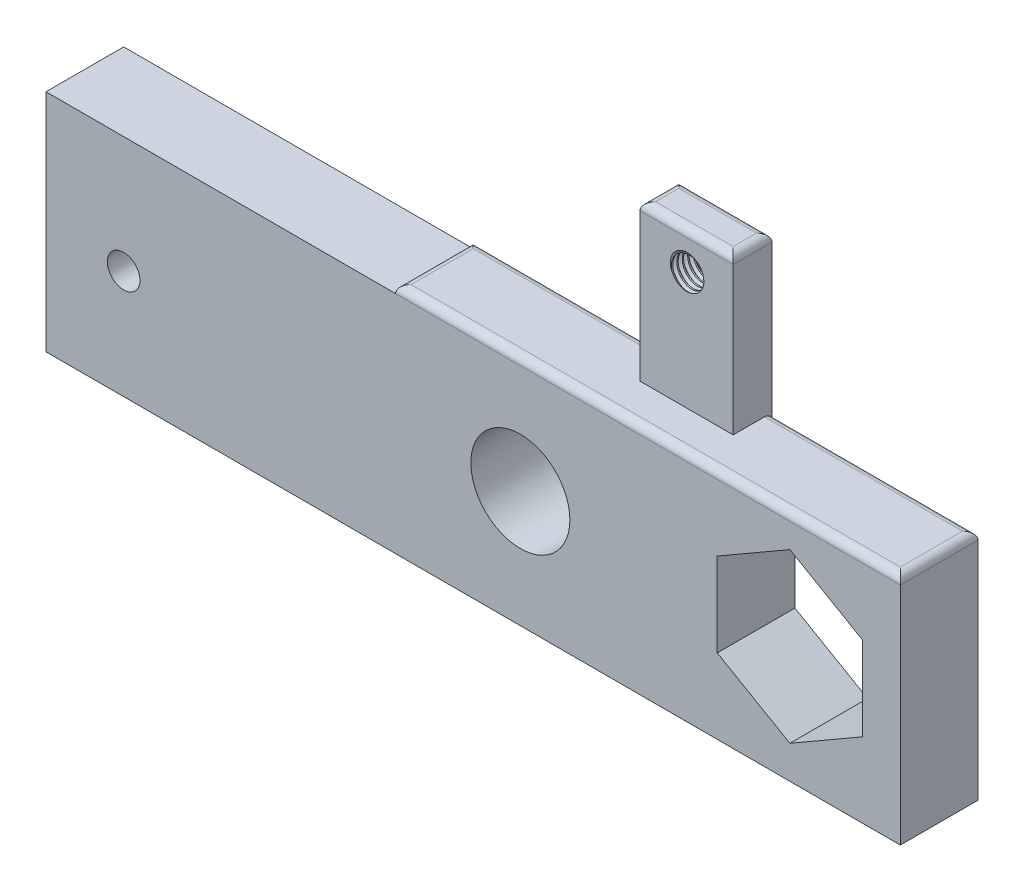
from build123d import *

# Parameters (mm, degrees)
SKETCH1_W           = 65
SKETCH1_H           = 30
BOSS_EXTRUDE1_DEPTH = 10
SKETCH2_R           = 6.375
CUT_EXTRUDE1_DEPTH  = 10
SKETCH4_W           = 12
SKETCH4_H           = 5
BOSS_EXTRUDE5_DEPTH = 20
SKETCH9_R           = 2
CUT_EXTRUDE3_DEPTH  = 30
THREAD1_PITCH       = 0.7
FILLET1_R           = 1
SKETCH10_W          = 10
SKETCH10_H          = 29
BOSS_EXTRUDE6_DEPTH = 45
SKETCH11_R          = 2.1
CUT_EXTRUDE4_DEPTH  = 50


with BuildPart() as part:
    # Sketch1 → Boss-Extrude1 (new body)
    with BuildSketch(Plane.XY):
        Rectangle(SKETCH1_W, SKETCH1_H)
    extrude(amount=BOSS_EXTRUDE1_DEPTH)

    # Sketch2 → Cut-Extrude1 (cut)
    with BuildSketch(Plane.XY.offset(10)):
        with Locations((-16.423651497, -0.024123926)):
            Circle(SKETCH2_R)
        Polygon((18.279422863, -10.760304849), (27.632497224, -5.360304849), (27.632497224, 5.439695151), (18.279422863, 10.839695151), (8.926348503, 5.439695151), (8.926348503, -5.360304849), align=None)
    extrude(amount=-CUT_EXTRUDE1_DEPTH, mode=Mode.SUBTRACT)

    # Sketch4 → Boss-Extrude5 (add, symmetric)
    with BuildSketch(Plane(origin=(0, 15, 0), x_dir=(1, 0, 0), z_dir=(0, 1, 0))):
        with Locations((0, -2.5242509)):
            Rectangle(SKETCH4_W, SKETCH4_H)
    extrude(amount=BOSS_EXTRUDE5_DEPTH, both=True)

    # Sketch9 → Cut-Extrude3 (cut, symmetric)
    with BuildSketch(Plane(origin=(0, 0, 0), x_dir=(-1, 0, 0), z_dir=(0, 0, -1))):
        with Locations((0, 30)):
            Circle(SKETCH9_R)
    extrude(amount=CUT_EXTRUDE3_DEPTH, both=True, mode=Mode.SUBTRACT)

    # Thread1: the profile of Thread Profile2 profile screwed along a right-hand helix of 14.285714 turns, 6 arcs to a turn; built about Z, then put on its axis
    thread1_z = Axis((0, 0, 0), (0, 0, 1))
    thread1_corners = [(1.9997, 0, -0.000173205), (2.378886113, 0, 0.218749999), (2.378886113, 0, 0.306249999), (1.9997, 0, 0.525173203)]
    with BuildLine(mode=Mode.PRIVATE) as thread1_profile:
        Line(thread1_corners[0], thread1_corners[1])
        Line(thread1_corners[1], thread1_corners[2])
        Line(thread1_corners[2], thread1_corners[3])
        Line(thread1_corners[3], thread1_corners[0])
    thread1_cap = Face(thread1_profile.wire())
    thread1_turn_angles = [0, 30, 60, 90, 120, 150, 180, 210, 240, 270, 300, 330, 360]
    thread1_turn_weights = [1, 0.8660254037844387, 1, 0.8660254037844387, 1, 0.8660254037844387, 1, 0.8660254037844387, 1, 0.8660254037844387, 1, 0.8660254037844387, 1]
    thread1_turn_rails = [Edge.make_bspline([Vector(p[0], p[1], 0).rotate(thread1_z, thread1_turn_angles[k]) / thread1_turn_weights[k] + Vector(0, 0, p[2] + THREAD1_PITCH * thread1_turn_angles[k] / 360) for k in range(13)], [0, 0, 0, 1, 1, 2, 2, 3, 3, 4, 4, 5, 5, 6, 6, 6], 2, thread1_turn_weights) for p in thread1_corners]
    thread1_turn_sides = [Face.make_surface_from_curves(thread1_turn_rails[p[0]], thread1_turn_rails[p[1]]) for p in [(0, 1), (1, 2), (2, 3), (3, 0)]]
    thread1_last_angles = [5040, 5070, 5100, 5121.428571429, 5142.857142857]
    thread1_last_weights = [1, 0.8660254037844387, 1, 0.9308737486442035, 1]
    thread1_last_rails = [Edge.make_bspline([Vector(p[0], p[1], 0).rotate(thread1_z, thread1_last_angles[k]) / thread1_last_weights[k] + Vector(0, 0, p[2] + THREAD1_PITCH * thread1_last_angles[k] / 360) for k in range(5)], [0, 0, 0, 1, 1, 2, 2, 2], 2, thread1_last_weights) for p in thread1_corners]
    thread1_last_sides = [Face.make_surface_from_curves(thread1_last_rails[p[0]], thread1_last_rails[p[1]]) for p in [(0, 1), (1, 2), (2, 3), (3, 0)]]
    thread1 = Plane(origin=(0, 30, -0.9757491), x_dir=(1, 0, 0), z_dir=(0, 0, 1)) * Solid(Shell([*[p.moved(Location((0, 0, THREAD1_PITCH * i))) for i in range(14) for p in thread1_turn_sides], *thread1_last_sides, thread1_cap, thread1_cap.rotate(thread1_z, 5142.857142857).moved(Location((0, 0, THREAD1_PITCH * 5142.857142857 / 360)))]))
    add(thread1, mode=Mode.SUBTRACT)

    # Fillet1
    # the kernel refuses this fillet: 1 mm, written as the material it takes off along each edge
    with BuildSketch(Plane(origin=(-35, 15, 10), x_dir=(0, 0, -1), z_dir=(1, 0, 0))) as fillet1_piece_1:
        with BuildLine():
            CenterArc((FILLET1_R, -FILLET1_R), FILLET1_R, 90, 90)
            Line((0, -FILLET1_R), (0, 0))
            Line((0, 0), (FILLET1_R, 0))
        make_face()
    extrude(amount=70, mode=Mode.SUBTRACT)
    with BuildSketch(Plane(origin=(-35, 15, 0), x_dir=(0, 0, 1), z_dir=(1, 0, 0))) as fillet1_piece_2_section:
        with BuildLine():
            CenterArc((FILLET1_R, FILLET1_R), FILLET1_R, 180, 90)
            Line((0, FILLET1_R), (0, 0))
            Line((0, 0), (FILLET1_R, 0))
        make_face()
    fillet1_piece_2 = extrude(amount=70, mode=Mode.PRIVATE)
    fillet1_piece_2 = split(fillet1_piece_2, bisect_by=Plane(origin=(-6, 14.817863183, 0.270305417), z_dir=(-1, 0, 0)), keep=Keep.TOP, mode=Mode.PRIVATE)
    fillet1_piece_2 = split(fillet1_piece_2, bisect_by=Plane(origin=(-20.5, 14.817863183, 0.0242509), z_dir=(0, 0, 1)), keep=Keep.TOP, mode=Mode.PRIVATE)
    add(fillet1_piece_2, mode=Mode.SUBTRACT)
    with BuildSketch(Plane(origin=(-35, 15, 0), x_dir=(0, 0, 1), z_dir=(1, 0, 0))) as fillet1_piece_3_section:
        with BuildLine():
            CenterArc((FILLET1_R, FILLET1_R), FILLET1_R, 180, 90)
            Line((0, FILLET1_R), (0, 0))
            Line((0, 0), (FILLET1_R, 0))
        make_face()
    fillet1_piece_3 = extrude(amount=70, mode=Mode.PRIVATE)
    fillet1_piece_3 = split(fillet1_piece_3, bisect_by=Plane(origin=(-6, 14.546490451, 0.001066435), z_dir=(-1, 0, 0)), keep=Keep.TOP, mode=Mode.PRIVATE)
    fillet1_piece_3 = split(fillet1_piece_3, bisect_by=Plane(origin=(-20.5, 14.546490451, 0.0242509), z_dir=(0, 0, -1)), keep=Keep.TOP, mode=Mode.PRIVATE)
    add(fillet1_piece_3, mode=Mode.SUBTRACT)
    with BuildSketch(Plane(origin=(-35, 15, 0), x_dir=(0, 0, 1), z_dir=(1, 0, 0))) as fillet1_piece_4_section:
        with BuildLine():
            CenterArc((FILLET1_R, FILLET1_R), FILLET1_R, 180, 90)
            Line((0, FILLET1_R), (0, 0))
            Line((0, 0), (FILLET1_R, 0))
        make_face()
    fillet1_piece_4 = extrude(amount=70, mode=Mode.PRIVATE)
    fillet1_piece_4 = split(fillet1_piece_4, bisect_by=Plane(origin=(-6, 14.546490451, 0.001066435), z_dir=(1, 0, 0)), keep=Keep.TOP, mode=Mode.PRIVATE)
    fillet1_piece_4 = split(fillet1_piece_4, bisect_by=Plane(origin=(6, 14.546490451, 0.001066435), z_dir=(-1, 0, 0)), keep=Keep.TOP, mode=Mode.PRIVATE)
    fillet1_piece_4 = split(fillet1_piece_4, bisect_by=Plane(origin=(0, 14.546490451, 0.0242509), z_dir=(0, 0, -1)), keep=Keep.TOP, mode=Mode.PRIVATE)
    add(fillet1_piece_4, mode=Mode.SUBTRACT)
    with BuildSketch(Plane(origin=(-35, 15, 0), x_dir=(0, 0, 1), z_dir=(1, 0, 0))) as fillet1_piece_5_section:
        with BuildLine():
            CenterArc((FILLET1_R, FILLET1_R), FILLET1_R, 180, 90)
            Line((0, FILLET1_R), (0, 0))
            Line((0, 0), (FILLET1_R, 0))
        make_face()
    fillet1_piece_5 = extrude(amount=70, mode=Mode.PRIVATE)
    fillet1_piece_5 = split(fillet1_piece_5, bisect_by=Plane(origin=(6, 14.817863183, 0.270305417), z_dir=(1, 0, 0)), keep=Keep.TOP, mode=Mode.PRIVATE)
    fillet1_piece_5 = split(fillet1_piece_5, bisect_by=Plane(origin=(20.5, 14.817863183, 0.0242509), z_dir=(0, 0, 1)), keep=Keep.TOP, mode=Mode.PRIVATE)
    add(fillet1_piece_5, mode=Mode.SUBTRACT)
    with BuildSketch(Plane(origin=(-35, 15, 0), x_dir=(0, 0, 1), z_dir=(1, 0, 0))) as fillet1_piece_6_section:
        with BuildLine():
            CenterArc((FILLET1_R, FILLET1_R), FILLET1_R, 180, 90)
            Line((0, FILLET1_R), (0, 0))
            Line((0, 0), (FILLET1_R, 0))
        make_face()
    fillet1_piece_6 = extrude(amount=70, mode=Mode.PRIVATE)
    fillet1_piece_6 = split(fillet1_piece_6, bisect_by=Plane(origin=(6, 14.546490451, 0.001066435), z_dir=(1, 0, 0)), keep=Keep.TOP, mode=Mode.PRIVATE)
    fillet1_piece_6 = split(fillet1_piece_6, bisect_by=Plane(origin=(20.5, 14.546490451, 0.0242509), z_dir=(0, 0, -1)), keep=Keep.TOP, mode=Mode.PRIVATE)
    add(fillet1_piece_6, mode=Mode.SUBTRACT)
    with BuildSketch(Plane(origin=(-32.5, 15, -2.5), x_dir=(1, 0, 0), z_dir=(0, 0, 1))) as fillet1_piece_7:
        with BuildLine():
            CenterArc((FILLET1_R, -FILLET1_R), FILLET1_R, 90, 90)
            Line((0, -FILLET1_R), (0, 0))
            Line((0, 0), (FILLET1_R, 0))
        make_face()
    extrude(amount=15, mode=Mode.SUBTRACT)
    with BuildSketch(Plane(origin=(32.5, 15, -2.5), x_dir=(-1, 0, 0), z_dir=(0, 0, 1))) as fillet1_piece_8:
        with BuildLine():
            CenterArc((FILLET1_R, FILLET1_R), FILLET1_R, 180, 90)
            Line((0, FILLET1_R), (0, 0))
            Line((0, 0), (FILLET1_R, 0))
        make_face()
    extrude(amount=15, mode=Mode.SUBTRACT)
    with BuildSketch(Plane(origin=(8.5, 35, 5.0242509), x_dir=(0, -1, 0), z_dir=(-1, 0, 0)), Plane(origin=(-8.5, 35, 0.0242509), x_dir=(0, -1, 0), z_dir=(1, 0, 0))) as fillet1_piece_9:
        with BuildLine():
            CenterArc((FILLET1_R, -FILLET1_R), FILLET1_R, 90, 90)
            Line((0, -FILLET1_R), (0, 0))
            Line((0, 0), (FILLET1_R, 0))
        make_face()
    extrude(amount=17, mode=Mode.SUBTRACT)
    with BuildSketch(Plane(origin=(6, 35, -2.4757491), x_dir=(0, -1, 0), z_dir=(0, 0, 1)), Plane(origin=(-6, 35, 7.5242509), x_dir=(0, -1, 0), z_dir=(0, 0, -1))) as fillet1_piece_10:
        with BuildLine():
            CenterArc((FILLET1_R, -FILLET1_R), FILLET1_R, 90, 90)
            Line((0, -FILLET1_R), (0, 0))
            Line((0, 0), (FILLET1_R, 0))
        make_face()
    extrude(amount=10, mode=Mode.SUBTRACT)

    # Sketch10 → Boss-Extrude6 (add)
    with BuildSketch(Plane.ZY.offset(32.5)):
        with Locations((5, -0.5)):
            Rectangle(SKETCH10_W, SKETCH10_H)
    extrude(amount=BOSS_EXTRUDE6_DEPTH)

    # Sketch11 → Cut-Extrude4 (cut)
    with BuildSketch(Plane.XY.offset(10)):
        with Locations((-67.5, -1)):
            Circle(SKETCH11_R)
    extrude(amount=-CUT_EXTRUDE4_DEPTH, mode=Mode.SUBTRACT)


solid = part.part
